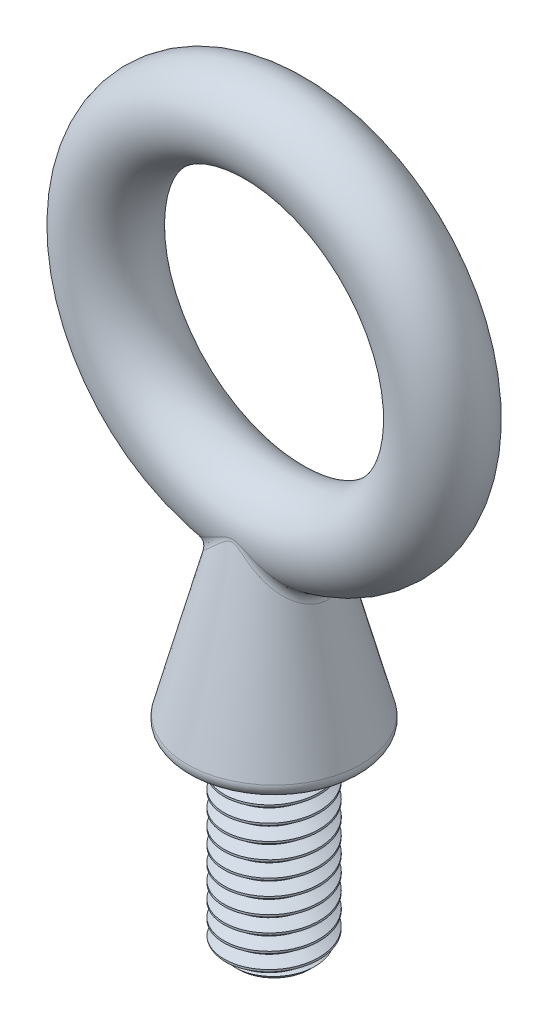
from build123d import *
from build123d.topology import SkipClean

# Parameters (mm, degrees)
BOSS_EXTRUDE1_START = -35.321875
SKETCH2_R           = 4.7625
BOSS_EXTRUDE1_DEPTH = 19.05
SKETCH5_OUTSIDE_W   = 58.604
SKETCH5_OUTSIDE_H   = 58.604
SKETCH5_OUTSIDE_R   = 3.559536588
CUT_EXTRUDE1_DEPTH  = 21.205576272
CUT_EXTRUDE1_DRAFT  = -45
SKETCH6_R           = 4.1671875
FILLET1_R           = 1.041796875
CUT_SWEEP1_PITCH    = 1.5875
CUT_SWEEP1_TO       = 19.05
SKETCH9_R           = 4.7625
BOSS_EXTRUDE2_DEPTH = 2.54
BOSS_EXTRUDE2_TAPER = 45


with BuildPart() as part:
    # Sketch2 → Boss-Extrude1 (new body)
    with BuildSketch(Plane(origin=(0, 0, 0), x_dir=(1, 0, 0), z_dir=(0, 1, 0)).offset(BOSS_EXTRUDE1_START)):
        with Locations(Location((0, 0, 0), (0, 0, 270))):
            Circle(SKETCH2_R)
    extrude(amount=-BOSS_EXTRUDE1_DEPTH)


with BuildPart() as cut_extrude1_tool:
    # Sketch5 outside → Cut-Extrude1 (with draft: the straight prism first)
    with BuildSketch(Plane.XZ.offset(54.371875)):
        Rectangle(SKETCH5_OUTSIDE_W, SKETCH5_OUTSIDE_H)
        Circle(SKETCH5_OUTSIDE_R, mode=Mode.SUBTRACT)
    extrude(amount=-CUT_EXTRUDE1_DEPTH)
    # Cut-Extrude1: the draft: its side faces are tilted about the plane it starts from
    cut_extrude1_sides = [cut_extrude1_tool.faces().sort_by_distance(p)[0] for p in [
        (0, -43.769086864, -29.302),
        (29.302, -43.769086864, 0),
        (0, -43.769086864, 29.302),
        (-29.302, -43.769086864, 0),
        (-3.559536588, -43.769086864, 0),
    ]]
    draft(cut_extrude1_sides, Plane.XZ.offset(54.371875), CUT_EXTRUDE1_DRAFT)


with BuildPart() as part_1:
    add(part.part)

    # Cut-Extrude1: cut by cut_extrude1_tool
    add(cut_extrude1_tool.part, mode=Mode.SUBTRACT)



with BuildPart() as body_2:
    # Sketch6 → Revolve1 (revolve)
    with BuildSketch(Plane(origin=(0, 0, 0), x_dir=(0, 0, -1), z_dir=(1, 0, 0)), mode=Mode.PRIVATE) as revolve1_sk:
        with Locations((0, 16.8671875)):
            Circle(SKETCH6_R)
    revolve(revolve1_sk.sketch.rotate(Axis((0, 0, -7.63984375), (0, 0, 1)), 90), axis=Axis((0, 0, -7.63984375), (0, 0, 1)))


with BuildPart() as part_2:
    with SkipClean():  # the faces are left unmerged after this step: merging them gives an invalid solid
        add(part_1.part)

        add(body_2.part)  # Revolve2 merges body 2
        # Sketch8 → Revolve2 (revolve)
        with BuildSketch(Plane.XY, mode=Mode.PRIVATE) as revolve2_sk:
            with BuildLine():
                Line((0, -35.321875), (0, -16.8671875))
                Line((0, -16.8671875), (-4.1671875, -16.8671875))
                Line((-4.1671875, -16.8671875), (-8.696699364, -34.014003432))
                ThreePointArc((-8.696699364, -34.014003432), (-8.514842885, -34.915745076), (-7.689453125, -35.321875))
                Line((-7.689453125, -35.321875), (0, -35.321875))
            make_face()
        revolve(revolve2_sk.sketch.rotate(Axis((0, -35.321875, 0), (0, 1, 0)), 270), axis=Axis((0, -35.321875, 0), (0, 1, 0)))

    # Fillet1
    fillet1_edges = [part_2.edges().sort_by_distance(p)[0] for p in [
        (5.102060777, -20.406222273, 1.0424e-05),
    ]]
    fillet(fillet1_edges, radius=FILLET1_R)


with BuildPart() as body_2_2:
    # Split1: the piece on the far side of the plane
    add(part_2.part)
    split(bisect_by=Plane(origin=(0, -35.321875, 0), x_dir=(-1, 0, 0), z_dir=(0, -1, 0)), keep=Keep.BOTTOM)


with BuildPart() as part_3:
    add(part_2.part)

    # Split1
    split(bisect_by=Plane(origin=(0, -35.321875, 0), x_dir=(-1, 0, 0), z_dir=(0, -1, 0)), keep=Keep.TOP)

    # Cut-Sweep1: arcs per turn and ends read off the stored shape
    # Cut-Sweep1: the profile of Sketch4 screwed along a right-hand helix through 13 turns, 8 arcs to a turn; built about Z, then put on its axis
    cut_sweep1_z = Axis((0, 0, 0), (0, 0, 1))
    cut_sweep1_corners = [(3.731388504, 0, -0.5953125), (3.731388504, 0, -0.79375), (4.848425958, 0, -1.438671875), (4.848425958, 0, 0.049609375)]
    with BuildLine(mode=Mode.PRIVATE) as cut_sweep1_profile:
        Line(cut_sweep1_corners[0], cut_sweep1_corners[1])
        Line(cut_sweep1_corners[1], cut_sweep1_corners[2])
        Line(cut_sweep1_corners[2], cut_sweep1_corners[3])
        Line(cut_sweep1_corners[3], cut_sweep1_corners[0])
    cut_sweep1_cap = Face(cut_sweep1_profile.wire())
    cut_sweep1_turn_angles = [0, 22.5, 45, 67.5, 90, 112.5, 135, 157.5, 180, 202.5, 225, 247.5, 270, 292.5, 315, 337.5, 360]
    cut_sweep1_turn_weights = [1, 0.9238795325112867, 1, 0.9238795325112867, 1, 0.9238795325112867, 1, 0.9238795325112867, 1, 0.9238795325112867, 1, 0.9238795325112867, 1, 0.9238795325112867, 1, 0.9238795325112867, 1]
    cut_sweep1_turn_rails = [Edge.make_bspline([Vector(p[0], p[1], 0).rotate(cut_sweep1_z, cut_sweep1_turn_angles[k]) / cut_sweep1_turn_weights[k] + Vector(0, 0, p[2] + CUT_SWEEP1_PITCH * cut_sweep1_turn_angles[k] / 360) for k in range(17)], [0, 0, 0, 1, 1, 2, 2, 3, 3, 4, 4, 5, 5, 6, 6, 7, 7, 8, 8, 8], 2, cut_sweep1_turn_weights) for p in cut_sweep1_corners]
    cut_sweep1_turn_sides = [Face.make_surface_from_curves(cut_sweep1_turn_rails[p[0]], cut_sweep1_turn_rails[p[1]]) for p in [(0, 1), (1, 2), (2, 3), (3, 0)]]
    cut_sweep1 = Plane(origin=(0, -54.371875, 0), x_dir=(1, 0, 0), z_dir=(0, 1, 0)) * split(Solid(Shell([*[p.moved(Location((0, 0, CUT_SWEEP1_PITCH * i))) for i in range(13) for p in cut_sweep1_turn_sides], cut_sweep1_cap, cut_sweep1_cap.rotate(cut_sweep1_z, 4680).moved(Location((0, 0, CUT_SWEEP1_PITCH * 4680 / 360)))])), bisect_by=Plane.XY.offset(CUT_SWEEP1_TO), keep=Keep.BOTTOM, mode=Mode.PRIVATE)
    add(cut_sweep1, mode=Mode.SUBTRACT)

    add(body_2_2.part)  # Boss-Extrude2 merges body 2 2
    # Sketch9 → Boss-Extrude2 (add)
    with BuildSketch(Plane.XZ.offset(35.321875)):
        Circle(SKETCH9_R)
    extrude(amount=BOSS_EXTRUDE2_DEPTH, taper=BOSS_EXTRUDE2_TAPER)


solid = part_3.part
